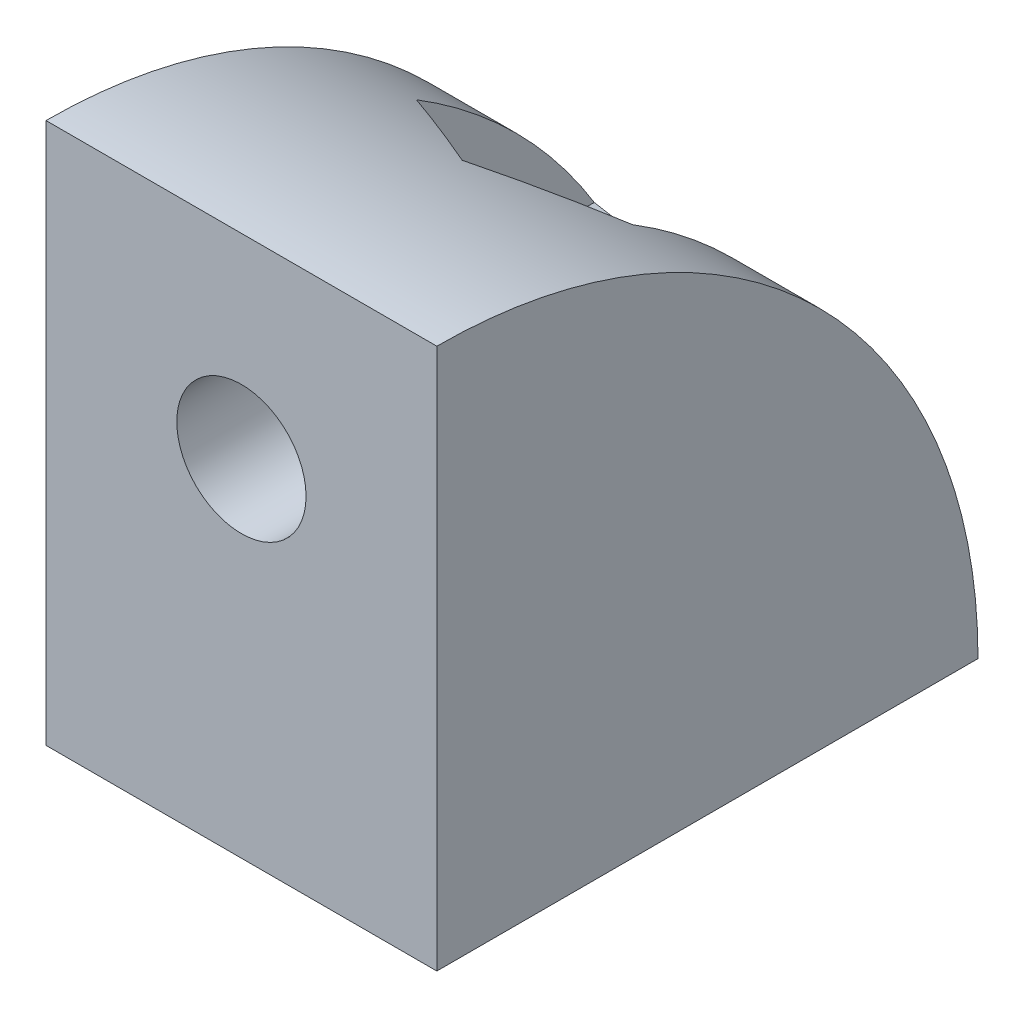
from build123d import *

# Parameters (mm, degrees)
EXTRUDE1_DEPTH = 13
SKETCH3_R      = 2.15
EXTRUDE2_DEPTH = 30
EXTRUDE3_START = -4
EXTRUDE3_DEPTH = 30


with BuildPart() as part:
    # Sketch2 → Extrude1 (new body)
    with BuildSketch(Plane(origin=(0, 0, 0), x_dir=(0, 0, -1), z_dir=(1, 0, 0))):
        with BuildLine():
            Line((0, 0), (18, 0))
            ThreePointArc((18, 0), (12.727922061, 12.727922061), (0, 18))
            Line((0, 18), (0, 0))
        make_face()
    extrude(amount=EXTRUDE1_DEPTH)

    # Sketch3 → Extrude2 (cut)
    with BuildSketch(Plane.XY):
        with Locations((6.5, 11.5)):
            Circle(SKETCH3_R)
    extrude2 = extrude(amount=-EXTRUDE2_DEPTH, mode=Mode.SUBTRACT)

    # Sketch5 → Extrude3 (cut)
    with BuildSketch(Plane.XY.offset(EXTRUDE3_START)):
        Polygon((6.5, 15.656921938), (2.9, 13.578460969), (2.9, 9.421539031), (6.5, 7.343078062), (10.1, 9.421539031), (10.1, 13.578460969), align=None)
    extrude3 = extrude(amount=-EXTRUDE3_DEPTH, mode=Mode.SUBTRACT)

    # Mirror1: Extrude2, Extrude3 across plane
    add(extrude2.mirror(Plane(origin=(0, 0, 0), x_dir=(0, -0.7071067811865478, 0.7071067811865472), z_dir=(0, 0.7071067811865475, 0.7071067811865477))), mode=Mode.SUBTRACT)
    add(extrude3.mirror(Plane(origin=(0, 0, 0), x_dir=(0, -0.7071067811865478, 0.7071067811865472), z_dir=(0, 0.7071067811865475, 0.7071067811865477))), mode=Mode.SUBTRACT)


solid = part.part
